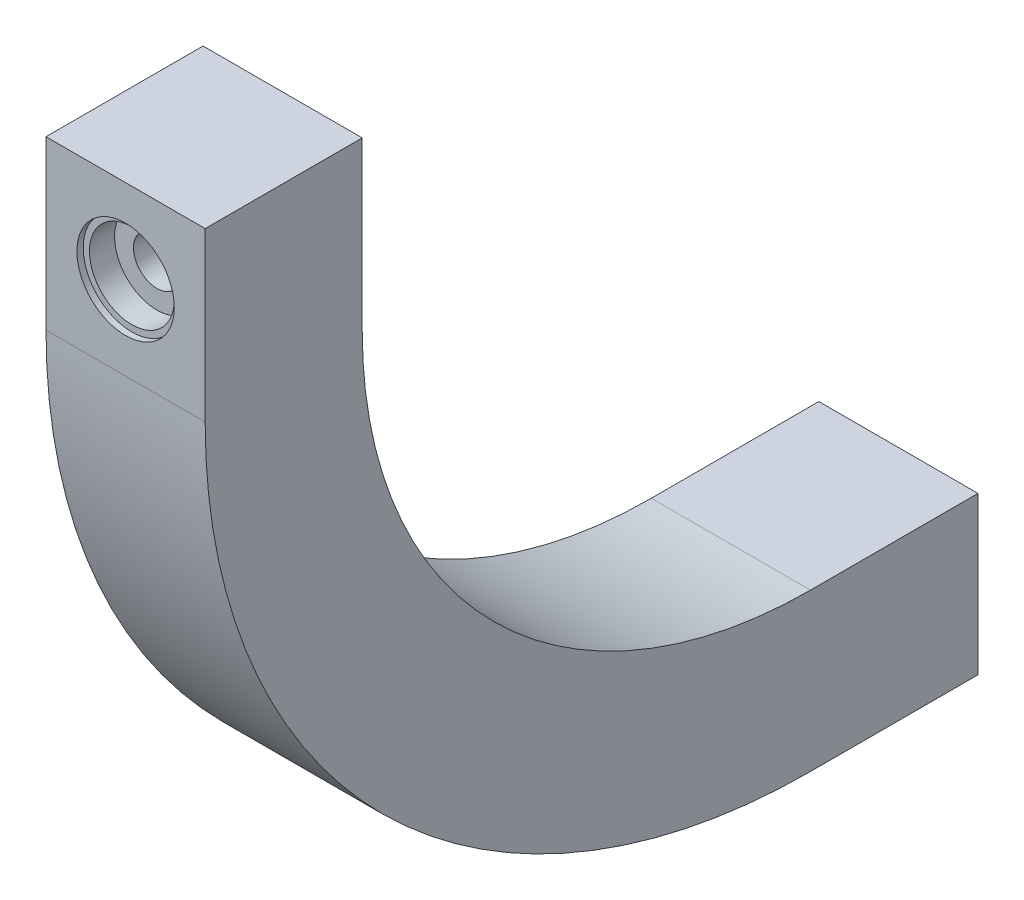
from build123d import *

# Parameters (mm, degrees)
BOSS_EXTRUDE1_DEPTH      = 7.6
BOSS_EXTRUDE1_DEPTH_BACK = 7.6
SKETCH7_R                = 2.25
CUT_EXTRUDE1_DEPTH       = 94.371547498
SKETCH15_R               = 2.05
CUT_EXTRUDE11_DEPTH      = 10


with BuildPart() as part:
    # Sketch5 → Boss-Extrude1 (new, two sides: drawn at the far end of the back side and taken through both)
    with BuildSketch(Plane(origin=(0, 0, 0), x_dir=(0, 0, -1), z_dir=(1, 0, 0)).offset(-BOSS_EXTRUDE1_DEPTH_BACK)):
        with BuildLine():
            Line((-50.80458146, 8), (-50.80458146, 0))
            Line((-50.80458146, 0), (-50.80458146, -8))
            ThreePointArc((-50.80458146, -8), (-38.267409816, -38.267409816), (-8, -50.80458146))
            Line((-8, -50.80458146), (0, -50.80458146))
            Line((0, -50.80458146), (8, -50.80458146))
            Line((8, -50.80458146), (8, -65.80458146))
            Line((8, -65.80458146), (-8, -65.80458146))
            ThreePointArc((-8, -65.80458146), (-48.874011534, -48.874011534), (-65.80458146, -8))
            Line((-65.80458146, -8), (-65.80458146, 8))
            Line((-65.80458146, 8), (-50.80458146, 8))
        make_face()
    extrude(amount=BOSS_EXTRUDE1_DEPTH + BOSS_EXTRUDE1_DEPTH_BACK)

    # Sketch7 → Cut-Extrude1 (cut, through all)
    with BuildSketch(Plane.XY):
        Circle(SKETCH7_R)
    extrude(amount=CUT_EXTRUDE1_DEPTH, mode=Mode.SUBTRACT)

    # Sketch15 → Cut-Extrude11 (cut)
    with BuildSketch(Plane.XZ.offset(65.80458146)):
        Circle(SKETCH15_R)
    extrude(amount=-CUT_EXTRUDE11_DEPTH, mode=Mode.SUBTRACT)

    # Sketch18 → Cut-Revolve1 (revolve, cut)
    with BuildSketch(Plane(origin=(0, 0, 0), x_dir=(0, 0, -1), z_dir=(1, 0, 0))):
        Polygon((-65.80458146, 4.65), (-65.80458146, 0), (-62.80458146, 0), (-62.80458146, 4.05), (-65.20458146, 4.05), (-65.20458146, 4.65), align=None)
        Polygon((-51.40458146, 4.65), (-50.80458146, 4.65), (-50.80458146, 0), (-53.80458146, 0), (-53.80458146, 4.05), (-51.40458146, 4.05), align=None)
    revolve(axis=Axis((0, 0, 109.558527697), (0, 0, -1)), mode=Mode.SUBTRACT)


solid = part.part
